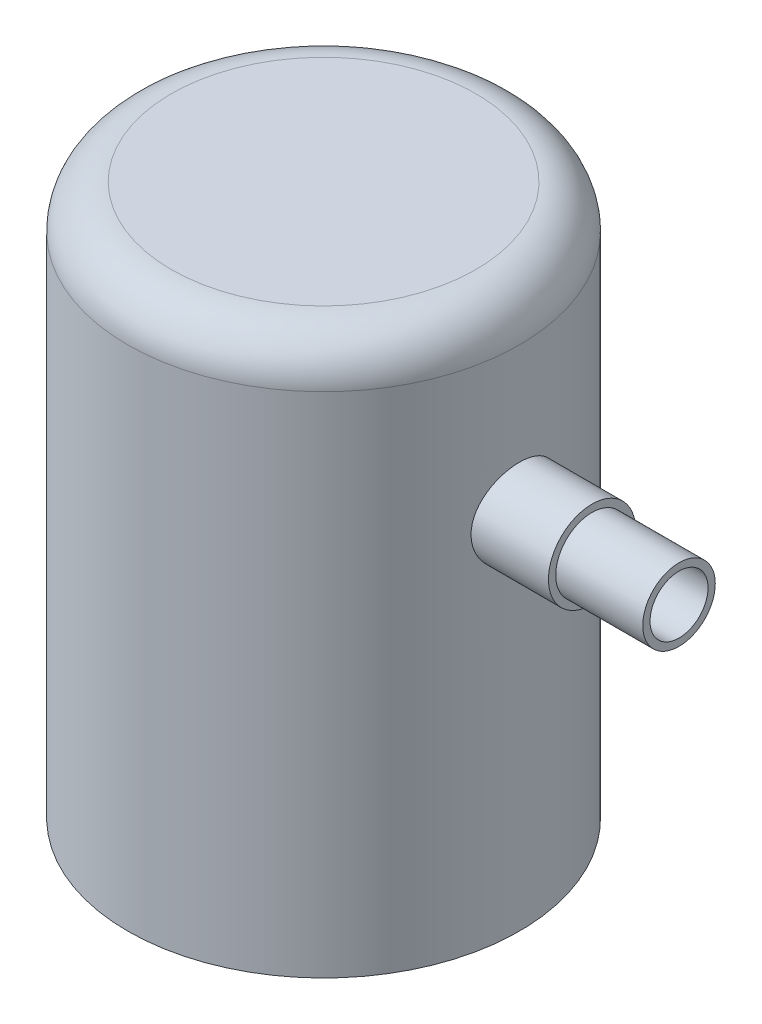
from build123d import *

# Parameters (mm, degrees)
SKETCH1_R                 = 13.5
BOSS_EXTRUDE1_DEPTH       = 38
FILLET1_R                 = 3
SKETCH2_R                 = 6
SKETCH2_R_2               = 1.5
SKETCH2_R_3               = 3.5
CUT_EXTRUDE5_DEPTH        = 1
SKETCH7_R                 = 6
CUT_EXTRUDE6_DEPTH        = 27
SKETCH8_R                 = 3.5
CUT_EXTRUDE7_DEPTH        = 32
SKETCH9_R                 = 1.5
CUT_EXTRUDE8_DEPTH        = 3
F_4_0MM_DOWEL_HOLE1_D     = 4
F_4_0MM_DOWEL_HOLE1_DEPTH = 20
F_4_0MM_DOWEL_HOLE1_TIP   = 1.201721238
BOSS_EXTRUDE2_REACH       = 57.41
SKETCH12_R                = 3
SKETCH12_R_2              = 2
SKETCH13_R                = 3
SKETCH13_R_2              = 2.5
CUT_EXTRUDE9_DEPTH        = 6


with BuildPart() as part:
    # Sketch1 → Boss-Extrude1 (new body)
    with BuildSketch(Plane(origin=(0, 0, 0), x_dir=(1, 0, 0), z_dir=(0, 1, 0))):
        Circle(SKETCH1_R)
    extrude(amount=BOSS_EXTRUDE1_DEPTH)

    # Fillet1
    fillet1_edges = [part.edges().sort_by_distance(p)[0] for p in [
        (-13.5, 38, 0),
    ]]
    fillet(fillet1_edges, radius=FILLET1_R)

    # Sketch2 → Cut-Extrude5 (cut)
    with BuildSketch(Plane.XZ):
        with Locations((-6, 0)):
            Circle(SKETCH2_R)
        with Locations((0, 10)):
            Circle(SKETCH2_R_2)
        with Locations((0, -10)):
            Circle(SKETCH2_R_2)
        with Locations((7, 0)):
            Circle(SKETCH2_R_3)
    extrude(amount=-CUT_EXTRUDE5_DEPTH, mode=Mode.SUBTRACT)

    # Sketch7 → Cut-Extrude6 (cut)
    with BuildSketch(Plane.XZ):
        with Locations((-6, 0)):
            Circle(SKETCH7_R)
    extrude(amount=-CUT_EXTRUDE6_DEPTH, mode=Mode.SUBTRACT)

    # Sketch8 → Cut-Extrude7 (cut)
    with BuildSketch(Plane.XZ):
        with Locations((7, 0)):
            Circle(SKETCH8_R)
    extrude(amount=-CUT_EXTRUDE7_DEPTH, mode=Mode.SUBTRACT)

    # Sketch9 → Cut-Extrude8 (cut)
    with BuildSketch(Plane.XZ):
        with Locations((0, 10)):
            Circle(SKETCH9_R)
        with Locations((0, -10)):
            Circle(SKETCH9_R)
    extrude(amount=-CUT_EXTRUDE8_DEPTH, mode=Mode.SUBTRACT)

    # Ø4.0mm Dowel Hole1
    with Locations(Plane(origin=(13.5, 25, 0), x_dir=(0, 0, 1), z_dir=(1, 0, 0))):
        with Locations((0, 0)):
            Hole(F_4_0MM_DOWEL_HOLE1_D / 2, depth=F_4_0MM_DOWEL_HOLE1_DEPTH)
            with Locations((0, 0, -(F_4_0MM_DOWEL_HOLE1_DEPTH + F_4_0MM_DOWEL_HOLE1_TIP / 2))):  # 118° drill point
                Cone(0, F_4_0MM_DOWEL_HOLE1_D / 2, F_4_0MM_DOWEL_HOLE1_TIP, mode=Mode.SUBTRACT)

    # Sketch12 → Boss-Extrude2 (add, up to next)
    with BuildSketch(Plane(origin=(24.5, 0, 0), x_dir=(0, 0, -1), z_dir=(1, 0, 0)), mode=Mode.PRIVATE) as boss_extrude2_sk1:
        with Locations((0, 25)):
            Circle(SKETCH12_R)
        with Locations((0, 25)):
            Circle(SKETCH12_R_2, mode=Mode.SUBTRACT)
    boss_extrude2_tool1 = extrude(boss_extrude2_sk1.sketch, amount=-BOSS_EXTRUDE2_REACH, mode=Mode.PRIVATE) - part.part
    add(boss_extrude2_tool1.solids().sort_by_distance((24.5, 25, 2.915147))[0])

    # Sketch13 → Cut-Extrude9 (cut)
    with BuildSketch(Plane(origin=(24.5, 0, 0), x_dir=(0, 0, -1), z_dir=(1, 0, 0))):
        with Locations((0, 25)):
            Circle(SKETCH13_R)
        with Locations((0, 25)):
            Circle(SKETCH13_R_2, mode=Mode.SUBTRACT)
    extrude(amount=-CUT_EXTRUDE9_DEPTH, mode=Mode.SUBTRACT)


solid = part.part
